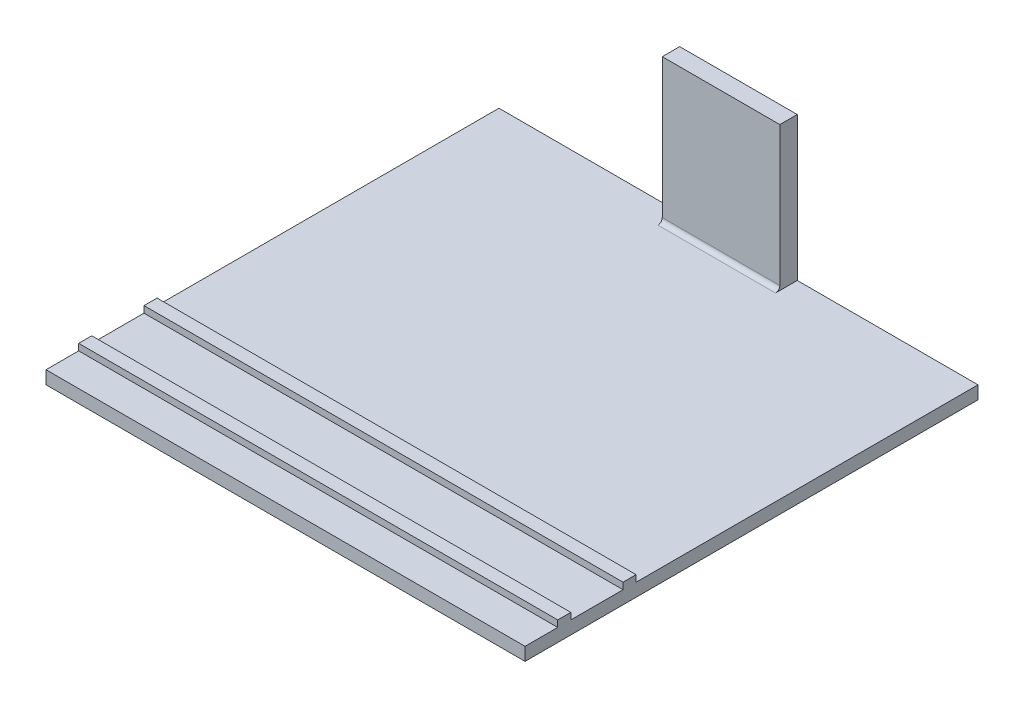
from build123d import *

# Parameters (mm, degrees)
SCHIZZO1_W                        = 27
SCHIZZO1_H                        = 36
ESTRUSIONE_ESTRUSIONE1_DEPTH      = 4
SCHIZZO3_W                        = 27
SCHIZZO3_H                        = 3
ESTRUSIONE_ESTRUSIONE2_DEPTH      = 100
RACCORDO1_R                       = 1
ESTRUSIONE_ESTRUSIONE3_DEPTH      = 170
ESTRUSIONE_ESTRUSIONE3_DEPTH_BACK = 150
SCHIZZO5_W                        = 104
SCHIZZO5_H                        = 3
SCHIZZO6_W                        = 3
SCHIZZO6_H                        = 1.5
ESTRUSIONE_ESTRUSIONE4_DEPTH      = 320
TAGLIO_ESTRUSIONE1_DEPTH          = 10
TAGLIO_ESTRUSIONE1_DEPTH_BACK     = 10
SCHIZZO7_W                        = 65
SCHIZZO7_H                        = 104
SCHIZZO8_R                        = 13.5
TAGLIO_ESTRUSIONE2_DEPTH          = 10
TAGLIO_ESTRUSIONE3_DEPTH          = 10
TAGLIO_ESTRUSIONE3_DEPTH_BACK     = 10
SCHIZZO9_OUTSIDE_W                = 235.914
SCHIZZO9_OUTSIDE_H                = 149.914
SCHIZZO9_OUTSIDE_W_2              = 110
SCHIZZO9_OUTSIDE_H_2              = 104


with BuildPart() as part:
    # Schizzo1 → Estrusione-Estrusione1 (new body)
    with BuildSketch(Plane.XY):
        with Locations((13.5, -18)):
            Rectangle(SCHIZZO1_W, SCHIZZO1_H)
    extrude(amount=ESTRUSIONE_ESTRUSIONE1_DEPTH)

    # Schizzo3 → Estrusione-Estrusione2 (add)
    with BuildSketch(Plane.XY.offset(4)):
        with Locations((13.5, -34.5)):
            Rectangle(SCHIZZO3_W, SCHIZZO3_H)
    extrude(amount=ESTRUSIONE_ESTRUSIONE2_DEPTH)

    # Raccordo1
    raccordo1_edges = [part.edges().sort_by_distance(p)[0] for p in [
        (13.5, -33, 4),
    ]]
    fillet(raccordo1_edges, radius=RACCORDO1_R)

    # Schizzo5 → Estrusione-Estrusione3 (add, two sides: drawn at the far end of the back side and taken through both)
    with BuildSketch(Plane(origin=(27, 0, 0), x_dir=(0, 0, -1), z_dir=(1, 0, 0)).offset(-ESTRUSIONE_ESTRUSIONE3_DEPTH_BACK)):
        with Locations((-52, -34.5)):
            Rectangle(SCHIZZO5_W, SCHIZZO5_H)
    extrude(amount=ESTRUSIONE_ESTRUSIONE3_DEPTH + ESTRUSIONE_ESTRUSIONE3_DEPTH_BACK)

    # Schizzo6 → Estrusione-Estrusione4 (add)
    with BuildSketch(Plane.ZY.offset(123)):
        with Locations((95, -32.25)):
            Rectangle(SCHIZZO6_W, SCHIZZO6_H)
        with Locations((80, -32.25)):
            Rectangle(SCHIZZO6_W, SCHIZZO6_H)
    extrude(amount=-ESTRUSIONE_ESTRUSIONE4_DEPTH)

    # Schizzo7 → Taglio-Estrusione1 (cut, two sides: drawn at the far end of the back side and taken through both)
    with BuildSketch(Plane(origin=(0, -33, 0), x_dir=(1, 0, 0), z_dir=(0, 1, 0)).offset(-TAGLIO_ESTRUSIONE1_DEPTH_BACK)):
        with Locations((-90.5, -52)):
            Rectangle(SCHIZZO7_W, SCHIZZO7_H)
        with Locations((164.5, -52)):
            Rectangle(SCHIZZO7_W, SCHIZZO7_H)
    extrude(amount=TAGLIO_ESTRUSIONE1_DEPTH + TAGLIO_ESTRUSIONE1_DEPTH_BACK, mode=Mode.SUBTRACT)

    # Schizzo8 → Taglio-Estrusione2 (cut)
    with BuildSketch(Plane(origin=(0, -33, 0), x_dir=(1, 0, 0), z_dir=(0, 1, 0))):
        with Locations((104, -24)):
            Circle(SCHIZZO8_R)
    extrude(amount=-TAGLIO_ESTRUSIONE2_DEPTH, mode=Mode.SUBTRACT)

    # Schizzo9 outside → Taglio-Estrusione3 (cut, two sides: drawn at the far end of the back side and taken through both)
    with BuildSketch(Plane(origin=(0, -33, 0), x_dir=(1, 0, 0), z_dir=(0, 1, 0)).offset(-TAGLIO_ESTRUSIONE3_DEPTH_BACK)):
        with Locations((37, -52)):
            Rectangle(SCHIZZO9_OUTSIDE_W, SCHIZZO9_OUTSIDE_H)
        with Locations((13.5, -52)):
            Rectangle(SCHIZZO9_OUTSIDE_W_2, SCHIZZO9_OUTSIDE_H_2, mode=Mode.SUBTRACT)
    extrude(amount=TAGLIO_ESTRUSIONE3_DEPTH + TAGLIO_ESTRUSIONE3_DEPTH_BACK, mode=Mode.SUBTRACT)


solid = part.part
